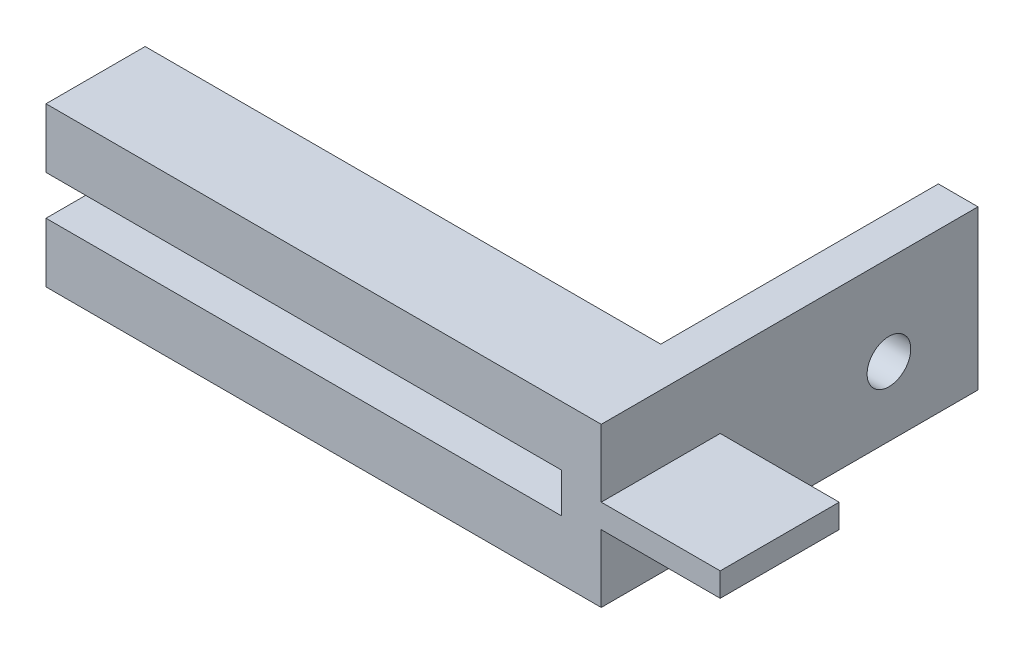
from build123d import *

# Parameters (mm, degrees)
SKETCH1_W           = 95
SKETCH1_H           = 40
BOSS_EXTRUDE1_DEPTH = 10
SKETCH4_W           = 25
SKETCH4_H           = 15
BOSS_EXTRUDE4_DEPTH = 130
SKETCH5_R           = 5.5
CUT_EXTRUDE1_DEPTH  = 27
SKETCH6_W           = 30
SKETCH6_H           = 6
BOSS_EXTRUDE5_DEPTH = 30


with BuildPart() as part:
    # Sketch1 → Boss-Extrude1 (new body)
    with BuildSketch(Plane(origin=(0, 0, 0), x_dir=(0, 0, -1), z_dir=(1, 0, 0))):
        with Locations((11.585365854, 0.129573171)):
            Rectangle(SKETCH1_W, SKETCH1_H)
    extrude(amount=BOSS_EXTRUDE1_DEPTH)

    # Sketch4 → Boss-Extrude4 (add)
    with BuildSketch(Plane.ZY):
        with Locations((23.414634146, 12.629573171)):
            Rectangle(SKETCH4_W, SKETCH4_H)
        with Locations((23.414634146, -12.370426829)):
            Rectangle(SKETCH4_W, SKETCH4_H)
    extrude(amount=BOSS_EXTRUDE4_DEPTH)

    # Sketch5 → Cut-Extrude1 (cut)
    with BuildSketch(Plane.ZY):
        with Locations((-36.625365854, -2.430426829)):
            Circle(SKETCH5_R)
    extrude(amount=-CUT_EXTRUDE1_DEPTH, mode=Mode.SUBTRACT)

    # Sketch6 → Boss-Extrude5 (add)
    with BuildSketch(Plane(origin=(10, 0, 0), x_dir=(0, 0, -1), z_dir=(1, 0, 0))):
        with Locations((-20.914634146, 0.129573171)):
            Rectangle(SKETCH6_W, SKETCH6_H)
    extrude(amount=BOSS_EXTRUDE5_DEPTH)


solid = part.part
